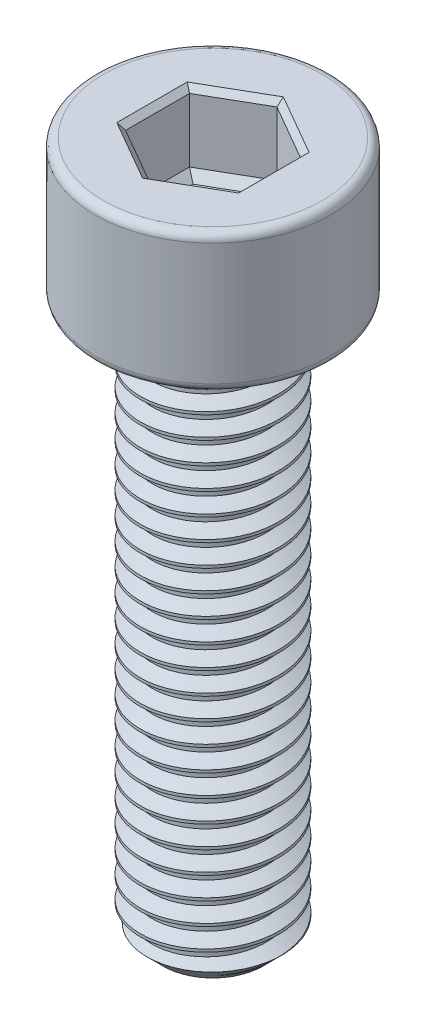
from build123d import *

# Parameters (mm, degrees)
SKETCH1_R           = 2.5
BOSS_EXTRUDE1_DEPTH = 20
THREAD1_PITCH       = 0.8
SKETCH5_R           = 4.25
BOSS_EXTRUDE2_DEPTH = 5
FILLET1_R           = 0.3
CUT_EXTRUDE1_DEPTH  = 2.5
CHAMFER1_SIZE       = 0.2
CUT_EXTRUDE2_DEPTH  = 0.3
CUT_EXTRUDE2_DRAFT  = -45


with BuildPart() as part:
    # Sketch1 → Boss-Extrude1 (new body)
    with BuildSketch(Plane(origin=(0, 0, 0), x_dir=(1, 0, 0), z_dir=(0, 1, 0))):
        with Locations(Location((0, 0, 0), (0, 0, 270))):
            Circle(SKETCH1_R)
    extrude(amount=BOSS_EXTRUDE1_DEPTH)

    # Thread1: the profile of Thread Profile1 profile screwed along a right-hand helix of 26.25 turns, 8 arcs to a turn; built about Z, then put on its axis
    thread1_z = Axis((0, 0, 0), (0, 0, 1))
    thread1_corners = [(2.5003, 0, -0.000173205), (2.5003, 0, 0.700173203), (2.0669873, 0, 0.449999999), (2.0669873, 0, 0.249999999)]
    with BuildLine(mode=Mode.PRIVATE) as thread1_profile:
        Line(thread1_corners[0], thread1_corners[1])
        Line(thread1_corners[1], thread1_corners[2])
        Line(thread1_corners[2], thread1_corners[3])
        Line(thread1_corners[3], thread1_corners[0])
    thread1_cap = Face(thread1_profile.wire())
    thread1_turn_angles = [0, 22.5, 45, 67.5, 90, 112.5, 135, 157.5, 180, 202.5, 225, 247.5, 270, 292.5, 315, 337.5, 360]
    thread1_turn_weights = [1, 0.9238795325112867, 1, 0.9238795325112867, 1, 0.9238795325112867, 1, 0.9238795325112867, 1, 0.9238795325112867, 1, 0.9238795325112867, 1, 0.9238795325112867, 1, 0.9238795325112867, 1]
    thread1_turn_rails = [Edge.make_bspline([Vector(p[0], p[1], 0).rotate(thread1_z, thread1_turn_angles[k]) / thread1_turn_weights[k] + Vector(0, 0, p[2] + THREAD1_PITCH * thread1_turn_angles[k] / 360) for k in range(17)], [0, 0, 0, 1, 1, 2, 2, 3, 3, 4, 4, 5, 5, 6, 6, 7, 7, 8, 8, 8], 2, thread1_turn_weights) for p in thread1_corners]
    thread1_turn_sides = [Face.make_surface_from_curves(thread1_turn_rails[p[0]], thread1_turn_rails[p[1]]) for p in [(0, 1), (1, 2), (2, 3), (3, 0)]]
    thread1_last_angles = [9360, 9382.5, 9405, 9427.5, 9450]
    thread1_last_weights = [1, 0.9238795325112867, 1, 0.9238795325112867, 1]
    thread1_last_rails = [Edge.make_bspline([Vector(p[0], p[1], 0).rotate(thread1_z, thread1_last_angles[k]) / thread1_last_weights[k] + Vector(0, 0, p[2] + THREAD1_PITCH * thread1_last_angles[k] / 360) for k in range(5)], [0, 0, 0, 1, 1, 2, 2, 2], 2, thread1_last_weights) for p in thread1_corners]
    thread1_last_sides = [Face.make_surface_from_curves(thread1_last_rails[p[0]], thread1_last_rails[p[1]]) for p in [(0, 1), (1, 2), (2, 3), (3, 0)]]
    thread1 = Plane(origin=(0, 21, 0), x_dir=(-1, 0, 0), z_dir=(0, -1, 0)) * Solid(Shell([*[p.moved(Location((0, 0, THREAD1_PITCH * i))) for i in range(26) for p in thread1_turn_sides], *thread1_last_sides, thread1_cap, thread1_cap.rotate(thread1_z, 9450).moved(Location((0, 0, THREAD1_PITCH * 9450 / 360)))]))
    add(thread1, mode=Mode.SUBTRACT)

    # Sketch5 → Boss-Extrude2 (add)
    with BuildSketch(Plane(origin=(0, 20, 0), x_dir=(1, 0, 0), z_dir=(0, 1, 0))):
        with Locations(Location((0, 0, 0), (0, 0, 270))):
            Circle(SKETCH5_R)
    extrude(amount=BOSS_EXTRUDE2_DEPTH)

    # Fillet1
    fillet1_edges = [part.edges().sort_by_distance(p)[0] for p in [
        (0, 20, -4.25),
        (0, 25, -4.25),
    ]]
    fillet(fillet1_edges, radius=FILLET1_R)

    # Sketch6 → Cut-Revolve1 (revolve, cut)
    with BuildSketch(Plane.XY, mode=Mode.PRIVATE) as cut_revolve1_sk:
        Polygon((2.51, 0), (2.51, 0.7), (1.81, 0), align=None)
    revolve(cut_revolve1_sk.sketch.rotate(Axis((0, 0, 0), (0, 1, 0)), 318.279472978), axis=Axis((0, 0, 0), (0, 1, 0)), mode=Mode.SUBTRACT)

    # Sketch7 → Cut-Extrude1 (cut)
    with BuildSketch(Plane(origin=(0, 25, 0), x_dir=(1, 0, 0), z_dir=(0, 1, 0))):
        Polygon((0, 2.309401077), (-2, 1.154700538), (-2, -1.154700538), (0, -2.309401077), (2, -1.154700538), (2, 1.154700538), align=None)
    extrude(amount=-CUT_EXTRUDE1_DEPTH, mode=Mode.SUBTRACT)

    # Chamfer1
    chamfer1_edges = [part.edges().sort_by_distance(p)[0] for p in [
        (1, 25, -1.732050808),
        (-1, 25, -1.732050808),
        (-2, 25, 0),
        (-1, 25, 1.732050808),
        (1, 25, 1.732050808),
        (2, 25, 0),
    ]]
    chamfer(chamfer1_edges, length=CHAMFER1_SIZE)


with BuildPart() as cut_extrude2_tool:
    # Sketch8 → Cut-Extrude2 (with draft: the straight prism first)
    with BuildSketch(Plane(origin=(0, 22.5, 0), x_dir=(1, 0, 0), z_dir=(0, 1, 0))):
        Polygon((0, 2.309401077), (-2, 1.154700538), (-2, -1.154700538), (0, -2.309401077), (2, -1.154700538), (2, 1.154700538), align=None)
    extrude(amount=-CUT_EXTRUDE2_DEPTH)
    # Cut-Extrude2: the draft: its side faces are tilted about the plane it starts from
    cut_extrude2_sides = [cut_extrude2_tool.faces().sort_by_distance(p)[0] for p in [
        (-1, 22.35, -1.732050808),
        (-2, 22.35, 0),
        (-1, 22.35, 1.732050808),
        (1, 22.35, 1.732050808),
        (2, 22.35, 0),
        (1, 22.35, -1.732050808),
    ]]
    draft(cut_extrude2_sides, Plane(origin=(0, 22.5, 0), x_dir=(1, 0, 0), z_dir=(0, 1, 0)), CUT_EXTRUDE2_DRAFT)


with BuildPart() as part_1:
    add(part.part)

    # Cut-Extrude2: cut by cut_extrude2_tool
    add(cut_extrude2_tool.part, mode=Mode.SUBTRACT)


solid = part_1.part
